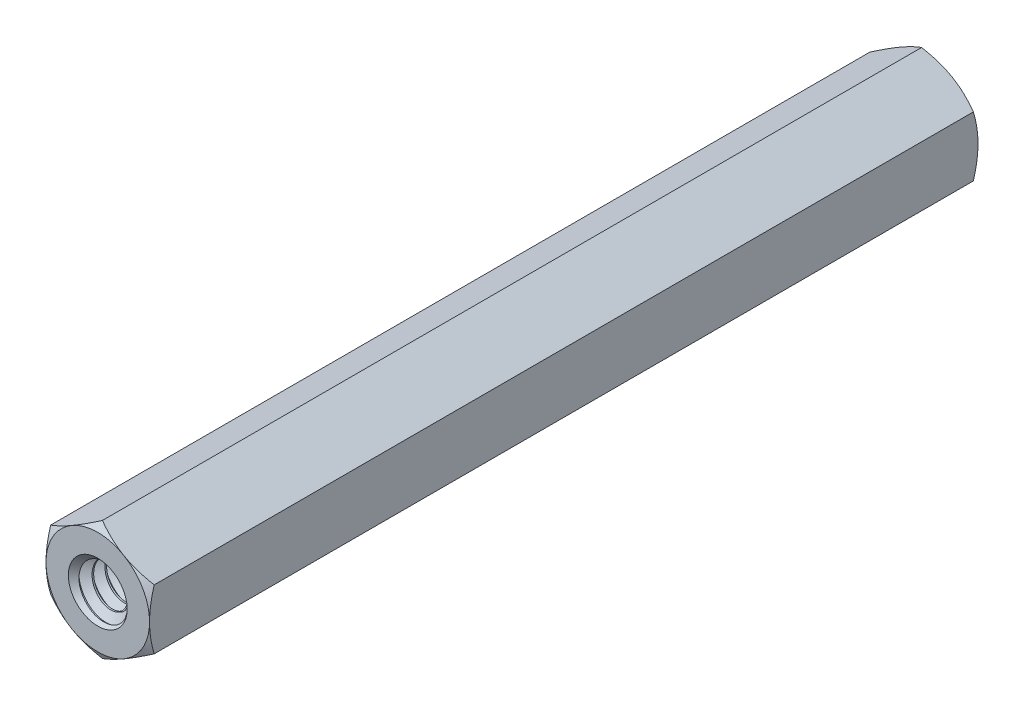
from build123d import *

# Parameters (mm, degrees)
EXTRUDE1_DEPTH          = 25.4
EXTRUDE1_DEPTH_BACK     = 25.4
SKETCH1_R               = 1.7526
SWEEP1_PITCH            = 0.79375
EXTRUDE2_DEPTH          = 52.821369933
SKETCH8_OUTSIDE_W       = 201.828
SKETCH8_OUTSIDE_H       = 202.81
SKETCH8_OUTSIDE_R       = 3.175
EXTRUDE4_DEPTH          = 52.821369933
EXTRUDE4_DRAFT          = -60
MIRROR1_COPY_1_SKETCH_W = 201.828
MIRROR1_COPY_1_SKETCH_H = 202.81
MIRROR1_COPY_1_SKETCH_R = 3.175
MIRROR1_COPY_1_DEPTH    = 52.821369933
MIRROR1_COPY_1_DRAFT    = -60
SKETCH9_W               = 31.75
SKETCH9_H               = 1.8034


with BuildPart() as part:
    # Sketch1 → Extrude1 (new, two sides: drawn at the far end of the back side and taken through both)
    with BuildSketch(Plane.XY.offset(-EXTRUDE1_DEPTH_BACK)):
        Polygon((0, 3.666174209), (-3.175, 1.833087105), (-3.175, -1.833087105), (0, -3.666174209), (3.175, -1.833087105), (3.175, 1.833087105), align=None)
        Circle(SKETCH1_R, mode=Mode.SUBTRACT)
    extrude(amount=EXTRUDE1_DEPTH + EXTRUDE1_DEPTH_BACK)

    # Sweep1: arcs per turn and ends read off the stored shape
    # Sweep1: the profile of Sketch12 profile screwed along a right-hand helix through 65 turns, 6 arcs to a turn; built about Z, then put on its axis
    sweep1_z = Axis((0, 0, 0), (0, 0, 1))
    sweep1_corners = [(1.7529, 0, -0.694704455), (1.7529, 0, 0.000173205), (1.237044252, 0, -0.29765625), (1.237044252, 0, -0.396875)]
    with BuildLine(mode=Mode.PRIVATE) as sweep1_profile:
        Line(sweep1_corners[0], sweep1_corners[1])
        Line(sweep1_corners[1], sweep1_corners[2])
        Line(sweep1_corners[2], sweep1_corners[3])
        Line(sweep1_corners[3], sweep1_corners[0])
    sweep1_cap = Face(sweep1_profile.wire())
    sweep1_turn_angles = [0, 30, 60, 90, 120, 150, 180, 210, 240, 270, 300, 330, 360]
    sweep1_turn_weights = [1, 0.8660254037844387, 1, 0.8660254037844387, 1, 0.8660254037844387, 1, 0.8660254037844387, 1, 0.8660254037844387, 1, 0.8660254037844387, 1]
    sweep1_turn_rails = [Edge.make_bspline([Vector(p[0], p[1], 0).rotate(sweep1_z, sweep1_turn_angles[k]) / sweep1_turn_weights[k] + Vector(0, 0, p[2] + SWEEP1_PITCH * sweep1_turn_angles[k] / 360) for k in range(13)], [0, 0, 0, 1, 1, 2, 2, 3, 3, 4, 4, 5, 5, 6, 6, 6], 2, sweep1_turn_weights) for p in sweep1_corners]
    sweep1_turn_sides = [Face.make_surface_from_curves(sweep1_turn_rails[p[0]], sweep1_turn_rails[p[1]]) for p in [(0, 1), (1, 2), (2, 3), (3, 0)]]
    sweep1 = Plane(origin=(0, 0, -25.4), x_dir=(0, 1, 0), z_dir=(0, 0, 1)) * Solid(Shell([*[p.moved(Location((0, 0, SWEEP1_PITCH * i))) for i in range(65) for p in sweep1_turn_sides], sweep1_cap, sweep1_cap.rotate(sweep1_z, 23400).moved(Location((0, 0, SWEEP1_PITCH * 23400 / 360)))]))
    add(sweep1)

    # Sketch6 → Extrude2 (cut, through all)
    with BuildSketch(Plane(origin=(0, 0, -25.4), x_dir=(-1, 0, 0), z_dir=(0, 0, -1))):
        Polygon((0, 3.666174209), (-3.175, 1.833087105), (-3.175, -1.833087105), (0, -3.666174209), (3.175, -1.833087105), (3.175, 1.833087105), align=None)
    extrude2 = extrude(amount=EXTRUDE2_DEPTH, mode=Mode.SUBTRACT)

    # Extrude3 cone 1 section (through the dimple's axis) → Extrude3 (revolve, cut)
    with BuildSketch(Plane(origin=(0, 0, -25.4), x_dir=(0, 1, 0), z_dir=(1, 0, 0))):
        Polygon((0, 0), (1.8034, 0), (0, 1.933909732), align=None)
    extrude3 = revolve(axis=Axis((0, 0, -25.4), (0, 0, 1)), mode=Mode.SUBTRACT)


with BuildPart() as extrude4_tool:
    # Sketch8 outside → Extrude4 (with draft: the straight prism first)
    with BuildSketch(Plane(origin=(0, 0, -25.4), x_dir=(-1, 0, 0), z_dir=(0, 0, -1))):
        Rectangle(SKETCH8_OUTSIDE_W, SKETCH8_OUTSIDE_H)
        Circle(SKETCH8_OUTSIDE_R, mode=Mode.SUBTRACT)
    extrude(amount=-EXTRUDE4_DEPTH)
    # Extrude4: the draft: its side faces are tilted about the plane it starts from
    extrude4_sides = [extrude4_tool.faces().sort_by_distance(p)[0] for p in [
        (0, -101.405, 1.010684966),
        (-100.914, 0, 1.010684966),
        (0, 101.405, 1.010684966),
        (100.914, 0, 1.010684966),
        (3.175, 0, 1.010684966),
    ]]
    draft(extrude4_sides, Plane(origin=(0, 0, -25.4), x_dir=(-1, 0, 0), z_dir=(0, 0, -1)), EXTRUDE4_DRAFT)


with BuildPart() as part_1:
    add(part.part)

    # Extrude4: cut by extrude4_tool
    add(extrude4_tool.part, mode=Mode.SUBTRACT)

    # Mirror1: Extrude2, Extrude3 across plane
    add(extrude2.mirror(Plane.XY), mode=Mode.SUBTRACT)
    add(extrude3.mirror(Plane.XY), mode=Mode.SUBTRACT)


with BuildPart() as mirror1_copy_1_tool:
    # Mirror1 copy 1 sketch → Mirror1 copy 1 (with draft: the straight prism first)
    with BuildSketch(Plane(origin=(0, 0, 25.4), x_dir=(-1, 0, 0), z_dir=(0, 0, 1))):
        Rectangle(MIRROR1_COPY_1_SKETCH_W, MIRROR1_COPY_1_SKETCH_H)
        Circle(MIRROR1_COPY_1_SKETCH_R, mode=Mode.SUBTRACT)
    extrude(amount=-MIRROR1_COPY_1_DEPTH)
    # Mirror1 copy 1: the draft: its side faces are tilted about the plane it starts from
    mirror1_copy_1_sides = [mirror1_copy_1_tool.faces().sort_by_distance(p)[0] for p in [
        (0, -101.405, -1.010684966),
        (-100.914, 0, -1.010684966),
        (0, 101.405, -1.010684966),
        (100.914, 0, -1.010684966),
        (3.175, 0, -1.010684966),
    ]]
    draft(mirror1_copy_1_sides, Plane(origin=(0, 0, 25.4), x_dir=(-1, 0, 0), z_dir=(0, 0, 1)), MIRROR1_COPY_1_DRAFT)


with BuildPart() as part_2:
    add(part_1.part)

    # Mirror1 copy 1: cut by mirror1_copy_1_tool
    add(mirror1_copy_1_tool.part, mode=Mode.SUBTRACT)

    # Sketch9 → Revolve 2 (revolve)
    with BuildSketch(Plane(origin=(0, 0, 0), x_dir=(0, 0, -1), z_dir=(1, 0, 0)), mode=Mode.PRIVATE) as revolve_2_sk:
        with Locations((0, 0.9017)):
            Rectangle(SKETCH9_W, SKETCH9_H)
    revolve(revolve_2_sk.sketch.rotate(Axis((0, 0, 25.4), (0, 0, -1)), 270), axis=Axis((0, 0, 25.4), (0, 0, -1)))


solid = part_2.part
